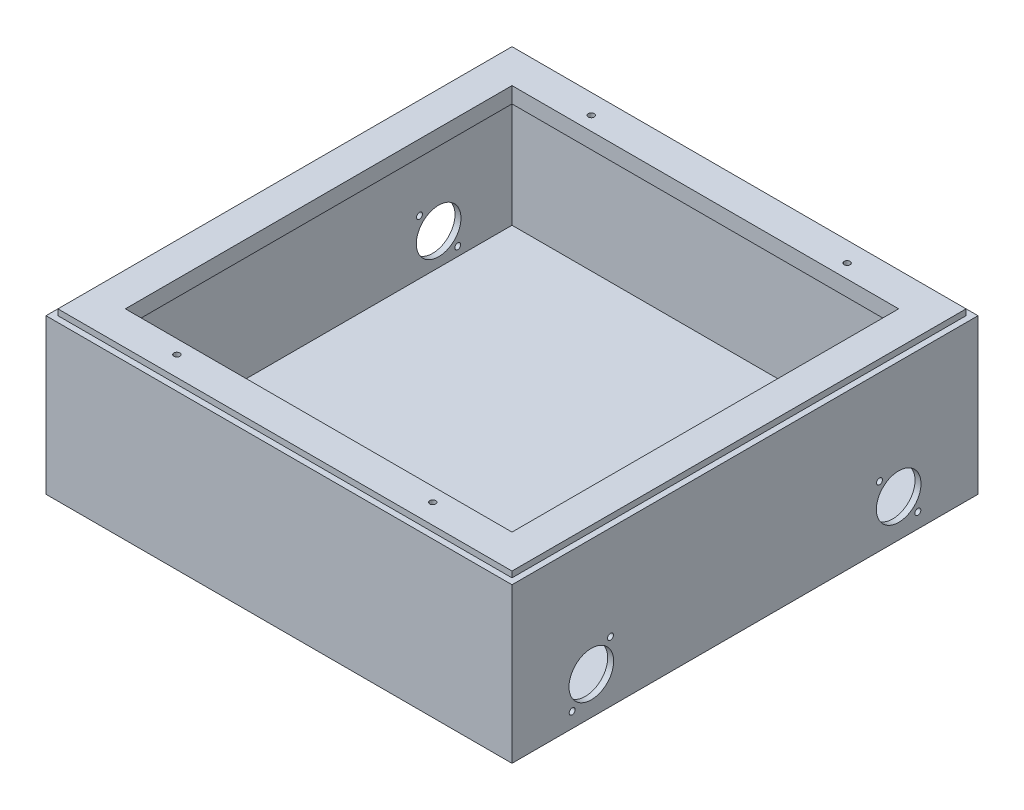
from build123d import *

# Parameters (mm, degrees)
SKETCH2_W               = 235
SKETCH2_H               = 235
BOSS_EXTRUDE1_DEPTH     = 3
SKETCH3_W               = 229
SKETCH3_H               = 229
BOSS_EXTRUDE3_DEPTH     = 75
SKETCH6_W               = 229
SKETCH6_H               = 229
SKETCH6_R               = 1.5
SKETCH6_W_2             = 195
SKETCH6_H_2             = 195
BOSS_EXTRUDE4_DEPTH     = 3
CUT_EXTRUDE1_DEPTH      = 600
CUT_EXTRUDE1_DEPTH_BACK = 600
SKETCH9_R               = 11.255
SKETCH9_R_2             = 1.5
SKETCH12_W              = 235
SKETCH12_H              = 235
SKETCH12_W_2            = 195
SKETCH12_H_2            = 195
BOSS_EXTRUDE5_DEPTH     = 5


with BuildPart() as part:
    # Sketch2 → Boss-Extrude1 (new body)
    with BuildSketch(Plane(origin=(0, 0, 0), x_dir=(1, 0, 0), z_dir=(0, 1, 0))):
        with Locations((117.5, -117.5)):
            Rectangle(SKETCH2_W, SKETCH2_H)
    extrude(amount=BOSS_EXTRUDE1_DEPTH)

    # Sketch3 → Boss-Extrude3 (add)
    with BuildSketch(Plane(origin=(0, 3, 0), x_dir=(1, 0, 0), z_dir=(0, 1, 0))):
        Polygon((3, 0), (0, 0), (0, -3), (0, -232), (0, -235), (3, -235), (232, -235), (235, -235), (235, -232), (235, -3), (235, 0), (232, 0), align=None)
        with Locations((117.5, -117.5)):
            Rectangle(SKETCH3_W, SKETCH3_H, mode=Mode.SUBTRACT)
    extrude(amount=BOSS_EXTRUDE3_DEPTH)

    # Sketch9 → Cut-Extrude1 (cut, two sides: drawn at the far end of the back side and taken through both)
    with BuildSketch(Plane(origin=(235, 0, 0), x_dir=(0, 0, -1), z_dir=(1, 0, 0)).offset(-CUT_EXTRUDE1_DEPTH_BACK)):
        with Locations((-195, 19)):
            Circle(SKETCH9_R)
        with Locations((-40, 19)):
            Circle(SKETCH9_R)
        with Locations((-185.341358162, 30.476525513)):
            Circle(SKETCH9_R_2)
        with Locations((-204.658641838, 7.523474487)):
            Circle(SKETCH9_R_2)
        with Locations((-30.341358162, 7.523474487)):
            Circle(SKETCH9_R_2)
        with Locations((-49.658641838, 30.476525513)):
            Circle(SKETCH9_R_2)
    extrude(amount=CUT_EXTRUDE1_DEPTH + CUT_EXTRUDE1_DEPTH_BACK, mode=Mode.SUBTRACT)



with BuildPart() as body_2:
    # Sketch6 → Boss-Extrude4 (new body)
    with BuildSketch(Plane(origin=(0, 78, 0), x_dir=(1, 0, 0), z_dir=(0, 1, 0))):
        with Locations((117.5, -117.5)):
            Rectangle(SKETCH6_W, SKETCH6_H)
        with Locations((53, -222)):
            Circle(SKETCH6_R, mode=Mode.SUBTRACT)
        with Locations((182, -222)):
            Circle(SKETCH6_R, mode=Mode.SUBTRACT)
        with Locations((117.5, -117.5)):
            Rectangle(SKETCH6_W_2, SKETCH6_H_2, mode=Mode.SUBTRACT)
        with Locations((53, -13)):
            Circle(SKETCH6_R, mode=Mode.SUBTRACT)
        with Locations((182, -13)):
            Circle(SKETCH6_R, mode=Mode.SUBTRACT)
    extrude(amount=BOSS_EXTRUDE4_DEPTH)


with BuildPart() as part_1:
    add(part.part)

    add(body_2.part)  # Boss-Extrude5 merges body 2
    # Sketch12 → Boss-Extrude5 (add)
    with BuildSketch(Plane.XZ.offset(-78)):
        with Locations((117.5, 117.5)):
            Rectangle(SKETCH12_W, SKETCH12_H)
        with Locations((117.5, 117.5)):
            Rectangle(SKETCH12_W_2, SKETCH12_H_2, mode=Mode.SUBTRACT)
    extrude(amount=BOSS_EXTRUDE5_DEPTH)


solid = part_1.part
